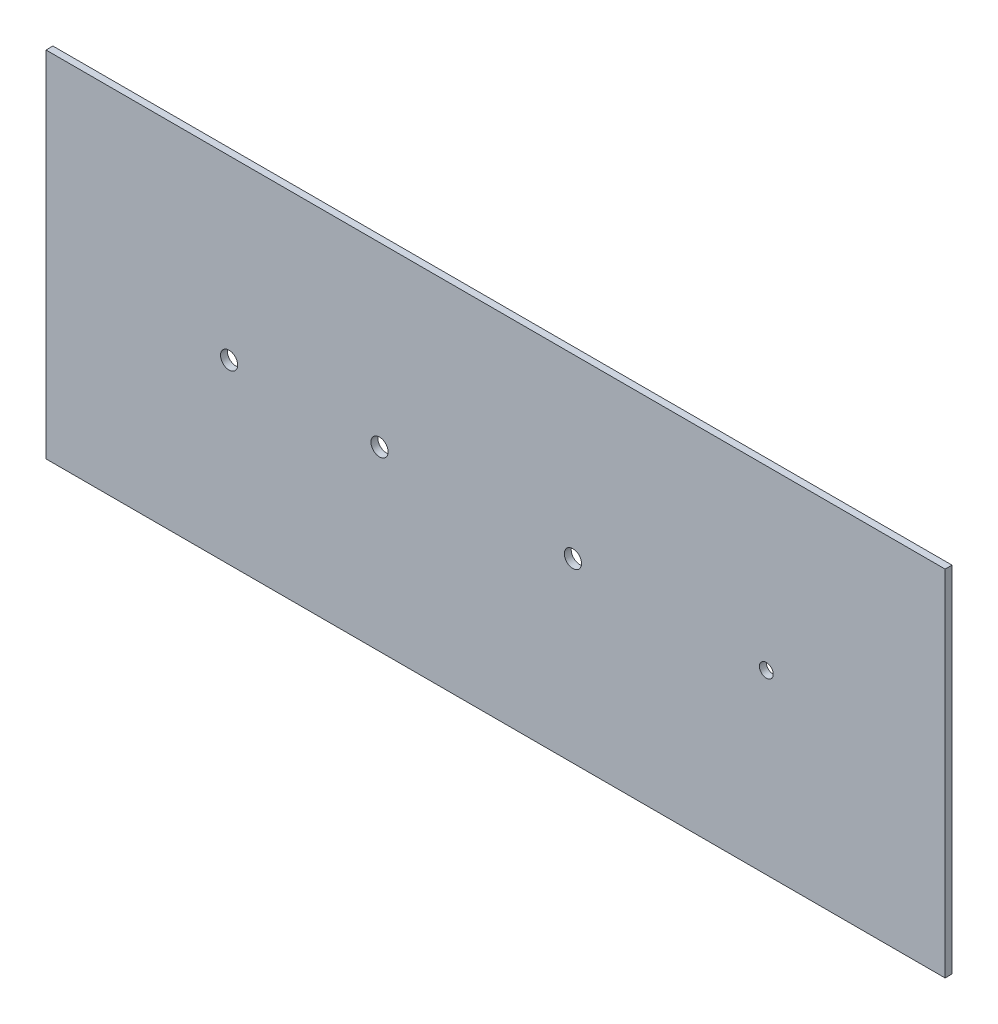
from build123d import *

# Parameters (mm, degrees)
SKETCH_1_W      = 261.5
SKETCH_1_H      = 103
SKETCH_1_R      = 2
SKETCH_1_R_2    = 2.5
EXTRUDE_1_DEPTH = 2


with BuildPart() as part:
    # Эскиз1 → Бобышка-Вытянуть1 (new body)
    with BuildSketch(Plane.XY):
        with Locations((130.75, 51.5)):
            Rectangle(SKETCH_1_W, SKETCH_1_H)
        with Locations((209.5, 51.5)):
            Circle(SKETCH_1_R, mode=Mode.SUBTRACT)
        with Locations((153.25, 51.5)):
            Circle(SKETCH_1_R_2, mode=Mode.SUBTRACT)
        with Locations((97, 51.5)):
            Circle(SKETCH_1_R_2, mode=Mode.SUBTRACT)
        with Locations((53.25, 51.5)):
            Circle(SKETCH_1_R_2, mode=Mode.SUBTRACT)
    extrude(amount=EXTRUDE_1_DEPTH)


solid = part.part
